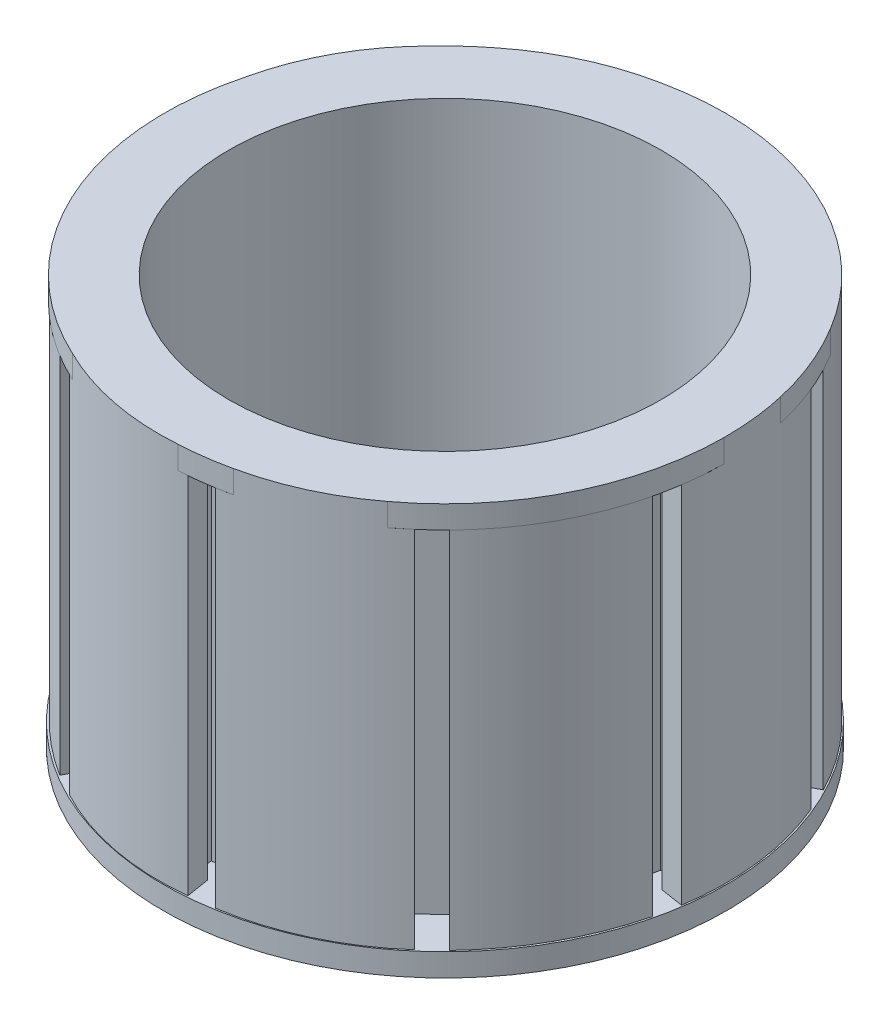
from build123d import *

# Parameters (mm, degrees)
BOSS_EXTRUDE1_DEPTH = 36
SKETCH6_R           = 4
CUT_EXTRUDE1_DEPTH  = 51.118905329
SKETCH7_R           = 19
CUT_EXTRUDE2_DEPTH  = 28
SKETCH8_R           = 24.640257617
SKETCH8_R_2         = 19
BOSS_EXTRUDE2_DEPTH = 2
BOSS_EXTRUDE3_START = -2
SKETCH9_R           = 24.765471232
SKETCH9_R_2         = 19
BOSS_EXTRUDE3_DEPTH = 2


with BuildPart() as part:
    # Sketch5 → Boss-Extrude1 (new body)
    with BuildSketch(Plane(origin=(0, 0, 0), x_dir=(1, 0, 0), z_dir=(0, 1, 0))):
        with BuildLine():
            Line((-24.362984614, 3.572359692), (-22.313286634, 3.256454852))
            Line((-22.313286634, 3.256454852), (-22.526139017, 2.16729886))
            Line((-22.526139017, 2.16729886), (-20.776467593, 1.825362779))
            Line((-20.776467593, 1.825362779), (-19.941416091, 6.131877613))
            Line((-19.941416091, 6.131877613), (-21.677029311, 6.475275507))
            Line((-21.677029311, 6.475275507), (-21.884939056, 5.40533318))
            Line((-21.884939056, 5.40533318), (-23.944192117, 5.722710675))
            ThreePointArc((-23.944192117, 5.722710675), (-21.682866171, 11.965840949), (-17.610288244, 17.210302759))
            Line((-17.610288244, 17.210302759), (-16.137731951, 15.74994813))
            Line((-16.137731951, 15.74994813), (-16.950122975, 14.993913915))
            Line((-16.950122975, 14.993913915), (-15.735594044, 13.688850755))
            Line((-15.735594044, 13.688850755), (-12.52871728, 16.682063485))
            Line((-12.52871728, 16.682063485), (-13.731013652, 17.980046071))
            Line((-13.731013652, 17.980046071), (-14.52811249, 17.236650828))
            Line((-14.52811249, 17.236650828), (-16.007533401, 18.703813195))
            ThreePointArc((-16.007533401, 18.703813195), (-10.474304885, 22.352615221), (-4.131060316, 24.274495129))
            Line((-4.131060316, 24.274495129), (-3.798112164, 22.227496544))
            Line((-3.798112164, 22.227496544), (-4.89973607, 22.093363479))
            Line((-4.89973607, 22.093363479), (-4.684258404, 20.32366301))
            Line((-4.684258404, 20.32366301), (-0.330474303, 20.860268108))
            Line((-0.330474303, 20.860268108), (-0.540217479, 22.617050155))
            Line((-0.540217479, 22.617050155), (-1.622040745, 22.484153711))
            Line((-1.622040745, 22.484153711), (-1.956541002, 24.540694793))
            ThreePointArc((-1.956541002, 24.540694793), (4.651309478, 24.170837782), (10.926092243, 22.066655419))
            Line((10.926092243, 22.066655419), (9.992257377, 20.214896763))
            Line((9.992257377, 20.214896763), (9.022183477, 20.753899119))
            Line((9.022183477, 20.753899119), (8.156304735, 19.19552677))
            Line((8.156304735, 19.19552677), (11.993998625, 17.070559328))
            Line((11.993998625, 17.070559328), (12.85692341, 18.615109805))
            Line((12.85692341, 18.615109805), (11.903595433, 19.143474085))
            Line((11.903595433, 19.143474085), (12.841783559, 21.003865088))
            ThreePointArc((12.841783559, 21.003865088), (18.005151406, 16.85334037), (21.809848929, 11.430103357))
            Line((21.809848929, 11.430103357), (19.965924224, 10.480893498))
            Line((19.965924224, 10.480893498), (19.49793559, 11.487150696))
            Line((19.49793559, 11.487150696), (17.881436687, 10.735351737))
            Line((17.881436687, 10.735351737), (19.73717174, 6.760477092))
            Line((19.73717174, 6.760477092), (21.343156548, 7.502830214))
            Line((21.343156548, 7.502830214), (20.882462745, 8.490638021))
            Line((20.882462745, 8.490638021), (22.734983277, 9.444272814))
            ThreePointArc((22.734983277, 9.444272814), (24.455073827, 3.049281996), (24.362984614, -3.572359692))
            Line((24.362984614, -3.572359692), (22.313286634, -3.256454852))
            Line((22.313286634, -3.256454852), (22.526139017, -2.16729886))
            Line((22.526139017, -2.16729886), (20.776467593, -1.825362779))
            Line((20.776467593, -1.825362779), (19.941416091, -6.131877613))
            Line((19.941416091, -6.131877613), (21.677029311, -6.475275507))
            Line((21.677029311, -6.475275507), (21.884939056, -5.40533318))
            Line((21.884939056, -5.40533318), (23.944192117, -5.722710675))
            ThreePointArc((23.944192117, -5.722710675), (21.522464999, -11.877400691), (17.610288244, -17.210302759))
            Line((17.610288244, -17.210302759), (16.137731951, -15.74994813))
            Line((16.137731951, -15.74994813), (16.950122975, -14.993913915))
            Line((16.950122975, -14.993913915), (15.735594044, -13.688850755))
            Line((15.735594044, -13.688850755), (12.52871728, -16.682063485))
            Line((12.52871728, -16.682063485), (13.731013652, -17.980046071))
            Line((13.731013652, -17.980046071), (14.52811249, -17.236650828))
            Line((14.52811249, -17.236650828), (16.007533401, -18.703813195))
            ThreePointArc((16.007533401, -18.703813195), (10.467433433, -22.337965558), (4.131060316, -24.274495129))
            Line((4.131060316, -24.274495129), (3.798112164, -22.227496544))
            Line((3.798112164, -22.227496544), (4.89973607, -22.093363479))
            Line((4.89973607, -22.093363479), (4.684258404, -20.32366301))
            Line((4.684258404, -20.32366301), (0.330474303, -20.860268108))
            Line((0.330474303, -20.860268108), (0.540217479, -22.617050155))
            Line((0.540217479, -22.617050155), (1.622040745, -22.484153711))
            Line((1.622040745, -22.484153711), (1.956541002, -24.540694793))
            ThreePointArc((1.956541002, -24.540694793), (-4.670838102, -24.272525776), (-10.926092243, -22.066655419))
            Line((-10.926092243, -22.066655419), (-9.992257377, -20.214896763))
            Line((-9.992257377, -20.214896763), (-9.022183477, -20.753899119))
            Line((-9.022183477, -20.753899119), (-8.156304735, -19.19552677))
            Line((-8.156304735, -19.19552677), (-11.993998625, -17.070559328))
            Line((-11.993998625, -17.070559328), (-12.85692341, -18.615109805))
            Line((-12.85692341, -18.615109805), (-11.903595433, -19.143474085))
            Line((-11.903595433, -19.143474085), (-12.841783559, -21.003865088))
            ThreePointArc((-12.841783559, -21.003865088), (-17.951040918, -16.802653253), (-21.809848929, -11.430103357))
            Line((-21.809848929, -11.430103357), (-19.965924224, -10.480893498))
            Line((-19.965924224, -10.480893498), (-19.49793559, -11.487150696))
            Line((-19.49793559, -11.487150696), (-17.881436687, -10.735351737))
            Line((-17.881436687, -10.735351737), (-19.73717174, -6.760477092))
            Line((-19.73717174, -6.760477092), (-21.343156548, -7.502830214))
            Line((-21.343156548, -7.502830214), (-20.882462745, -8.490638021))
            Line((-20.882462745, -8.490638021), (-22.734983277, -9.444272814))
            ThreePointArc((-22.734983277, -9.444272814), (-24.450836742, -3.04875206), (-24.362984614, 3.572359692))
        make_face()
    extrude(amount=BOSS_EXTRUDE1_DEPTH)

    # Sketch6 → Cut-Extrude1 (cut, through all)
    with BuildSketch(Plane(origin=(0, 36, 0), x_dir=(1, 0, 0), z_dir=(0, 1, 0))):
        Circle(SKETCH6_R)
    extrude(amount=-CUT_EXTRUDE1_DEPTH, mode=Mode.SUBTRACT)

    # Sketch7 → Cut-Extrude2 (cut)
    with BuildSketch(Plane(origin=(0, 36, 0), x_dir=(1, 0, 0), z_dir=(0, 1, 0))):
        Circle(SKETCH7_R)
    extrude(amount=-CUT_EXTRUDE2_DEPTH, mode=Mode.SUBTRACT)

    # Sketch8 → Boss-Extrude2 (add)
    with BuildSketch(Plane(origin=(0, 36, 0), x_dir=(1, 0, 0), z_dir=(0, 1, 0))):
        Circle(SKETCH8_R)
        Circle(SKETCH8_R_2, mode=Mode.SUBTRACT)
    extrude(amount=-BOSS_EXTRUDE2_DEPTH)

    # Sketch9 → Boss-Extrude3 (add)
    with BuildSketch(Plane.XZ.offset(BOSS_EXTRUDE3_START)):
        Circle(SKETCH9_R)
        Circle(SKETCH9_R_2, mode=Mode.SUBTRACT)
    extrude(amount=BOSS_EXTRUDE3_DEPTH)


solid = part.part
